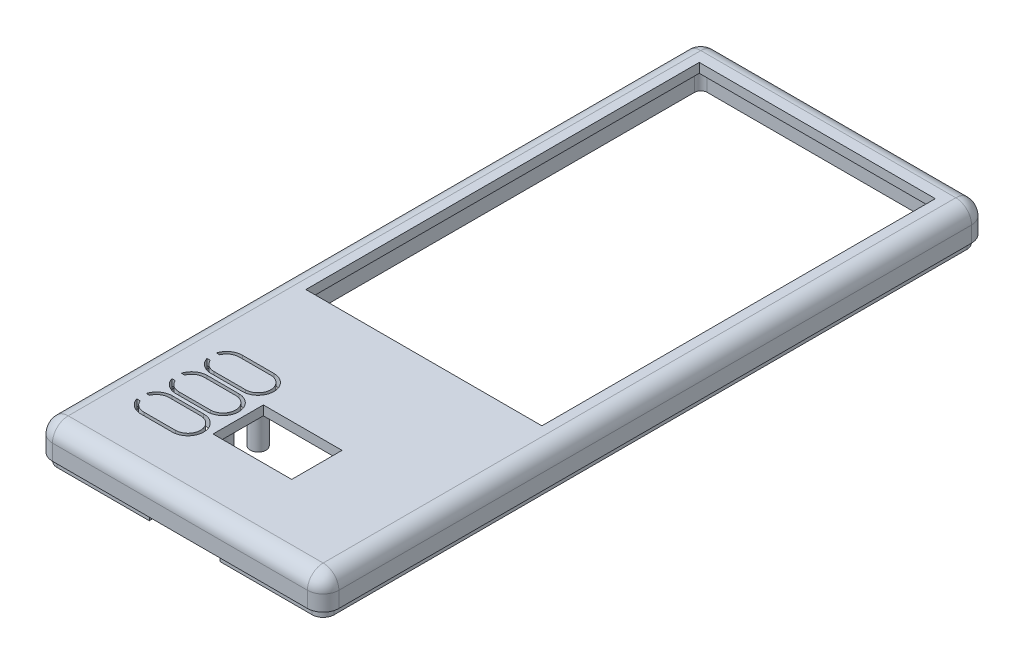
from build123d import *

# Parameters (mm, degrees)
SKETCH1_W           = 91
SKETCH1_H           = 211
BOSS_EXTRUDE1_DEPTH = 3
FILLET1_R           = 5
BOSS_EXTRUDE2_DEPTH = 7
CUT_EXTRUDE1_REACH  = 117.106
SKETCH3_W           = 25
SKETCH3_H           = 16
SKETCH4_R           = 2.499999999999999
BOSS_EXTRUDE3_DEPTH = 14.4
CUT_EXTRUDE4_REACH  = 117.792
SKETCH7_W           = 1.0616677240133683
SKETCH7_H           = 3.000000000000014
SKETCH7_W_2         = 1.0616677240133825
SKETCH7_W_3         = 1.0616677240133612
SKETCH7_H_2         = 3
CUT_EXTRUDE5_DEPTH  = 1
BOSS_EXTRUDE4_DEPTH = 2.5
FILLET2_R           = 5
CUT_EXTRUDE6_REACH  = 218.33


with BuildPart() as part:
    # Sketch1 → Boss-Extrude1 (new body)
    with BuildSketch(Plane(origin=(0, 0, 0), x_dir=(1, 0, 0), z_dir=(0, 1, 0))):
        Rectangle(SKETCH1_W, SKETCH1_H)
    extrude(amount=BOSS_EXTRUDE1_DEPTH)

    # Fillet1
    fillet1_edges = [part.edges().sort_by_distance(p)[0] for p in [
        (45.49999999999999, 1.5, -105.50000000000001),
        (-45.50000000000001, 1.5, -105.50000000000001),
        (-45.50000000000001, 1.5, 105.49999999999999),
        (45.49999999999999, 1.5, 105.49999999999999),
    ]]
    fillet(fillet1_edges, radius=FILLET1_R)

    # Sketch2 → Boss-Extrude2 (add)
    with BuildSketch(Plane.XZ):
        with BuildLine():
            Line((-40.499999999999964, -105.49999999999999), (40.49999999999995, -105.49999999999999))
            ThreePointArc((40.49999999999995, -105.49999999999999), (44.03553390593273, -104.03553390593272), (45.49999999999999, -100.49999999999996))
            Line((45.49999999999999, -100.49999999999996), (45.49999999999999, 100.49999999999996))
            ThreePointArc((45.49999999999999, 100.49999999999996), (44.03553390593273, 104.03553390593272), (40.49999999999995, 105.49999999999999))
            Line((40.49999999999995, 105.49999999999999), (-40.499999999999964, 105.49999999999999))
            ThreePointArc((-40.499999999999964, 105.49999999999999), (-44.03553390593273, 104.03553390593271), (-45.5, 100.49999999999996))
            Line((-45.5, 100.49999999999996), (-45.5, -100.49999999999996))
            ThreePointArc((-45.5, -100.49999999999996), (-44.03553390593274, -104.03553390593272), (-40.499999999999964, -105.49999999999999))
        make_face()
        with BuildLine():
            Line((-42.49999999999999, -100.49999999999996), (-42.49999999999999, 100.49999999999996))
            ThreePointArc((-42.49999999999999, 100.49999999999996), (-41.91421356237309, 101.91421356237306), (-40.499999999999986, 102.49999999999999))
            Line((-40.499999999999986, 102.49999999999999), (40.49999999999995, 102.49999999999999))
            ThreePointArc((40.49999999999995, 102.49999999999999), (41.914213562373085, 101.91421356237309), (42.49999999999999, 100.49999999999996))
            Line((42.49999999999999, 100.49999999999996), (42.499999999999986, -100.49999999999996))
            ThreePointArc((42.499999999999986, -100.49999999999996), (41.91421356237309, -101.91421356237308), (40.49999999999997, -102.49999999999999))
            Line((40.49999999999997, -102.49999999999999), (-40.499999999999964, -102.49999999999999))
            ThreePointArc((-40.499999999999964, -102.49999999999999), (-41.9142135623731, -101.91421356237308), (-42.49999999999999, -100.49999999999996))
        make_face(mode=Mode.SUBTRACT)
    extrude(amount=BOSS_EXTRUDE2_DEPTH)

    # Sketch3 → Cut-Extrude1 (cut, up to next)
    with BuildSketch(Plane.XZ, mode=Mode.PRIVATE) as cut_extrude1_sk1:
        Polygon((-37.50000000000003, 27.999999999999996), (37.49999999999997, 27.999999999999993), (37.499999999999986, -97), (-37.50000000000001, -97), align=None)
    cut_extrude1_tool1 = extrude(cut_extrude1_sk1.sketch, amount=-CUT_EXTRUDE1_REACH, mode=Mode.PRIVATE) & part.part
    # Sketch3 → Cut-Extrude1 (cut, up to next)
    with BuildSketch(Plane.XZ, mode=Mode.PRIVATE) as cut_extrude1_sk2:
        with Locations((-7.99e-15, 74.49999999999999)):
            Rectangle(SKETCH3_W, SKETCH3_H)
    cut_extrude1_tool2 = extrude(cut_extrude1_sk2.sketch, amount=-CUT_EXTRUDE1_REACH, mode=Mode.PRIVATE) & part.part
    add(cut_extrude1_tool1.solids().sort_by_distance((0, 0, -34.5))[0], mode=Mode.SUBTRACT)
    add(cut_extrude1_tool2.solids().sort_by_distance((0, 0, 74.5))[0], mode=Mode.SUBTRACT)

    # Sketch4 → Boss-Extrude3 (add)
    with BuildSketch(Plane.XZ):
        with Locations((-19.500000000000004, 83.44999999999997)):
            Circle(SKETCH4_R)
        with Locations((-19.499999999999996, 61.149999999999984)):
            Circle(SKETCH4_R)
        with Locations((-19.50000000000001, 72.29999999999997)):
            Circle(SKETCH4_R)
    extrude(amount=BOSS_EXTRUDE3_DEPTH)

    # Sketch5 → Cut-Extrude4 (cut, up to next)
    with BuildSketch(Plane.XZ, mode=Mode.PRIVATE) as cut_extrude4_sk1:
        with BuildLine():
            Line((-19.499999999999996, 87.44999999999997), (-29.5, 87.44999999999999))
            ThreePointArc((-29.5, 87.44999999999999), (-31.73609678257712, 86.76662660418015), (-33.2081687238052, 84.95))
            Line((-33.2081687238052, 84.95), (-34.26977162953215, 84.95))
            ThreePointArc((-34.26977162953215, 84.95), (-32.45807037601751, 87.48113127392654), (-29.500000000000007, 88.44999999999996))
            Line((-29.500000000000007, 88.44999999999996), (-19.499999999999993, 88.44999999999997))
            ThreePointArc((-19.499999999999993, 88.44999999999997), (-14.49999999999999, 83.44999999999997), (-19.499999999999996, 78.44999999999996))
            Line((-19.499999999999996, 78.44999999999996), (-29.545399744802786, 78.44999999999996))
            ThreePointArc((-29.545399744802786, 78.44999999999996), (-32.47642821141089, 79.43219789004968), (-34.269836447818555, 81.94999999999999))
            Line((-34.269836447818555, 81.94999999999999), (-33.20802976198858, 81.94999999999999))
            ThreePointArc((-33.20802976198858, 81.94999999999999), (-31.736039172051395, 80.13337702358305), (-29.500000000000007, 79.44999999999997))
            Line((-29.500000000000007, 79.44999999999997), (-19.499999999999996, 79.44999999999996))
            ThreePointArc((-19.499999999999996, 79.44999999999996), (-15.49999999999999, 83.44999999999997), (-19.499999999999996, 87.44999999999997))
        make_face()
    cut_extrude4_tool1 = extrude(cut_extrude4_sk1.sketch, amount=-CUT_EXTRUDE4_REACH, mode=Mode.PRIVATE) & part.part
    # Sketch5 → Cut-Extrude4 (cut, up to next)
    with BuildSketch(Plane.XZ, mode=Mode.PRIVATE) as cut_extrude4_sk2:
        with BuildLine():
            Line((-19.499999999999883, 76.29999999999998), (-29.499999999999883, 76.29999999999998))
            ThreePointArc((-29.499999999999883, 76.29999999999998), (-31.736096782576997, 75.61662660418014), (-33.20816872380508, 73.80000000000001))
            Line((-33.20816872380508, 73.80000000000001), (-34.26977162953204, 73.80000000000001))
            ThreePointArc((-34.26977162953204, 73.80000000000001), (-32.45807037601738, 76.33113127392653), (-29.49999999999989, 77.29999999999995))
            Line((-29.49999999999989, 77.29999999999995), (-19.49999999999988, 77.29999999999998))
            ThreePointArc((-19.49999999999988, 77.29999999999998), (-14.49999999999989, 72.29999999999997), (-19.499999999999883, 67.29999999999997))
            Line((-19.499999999999883, 67.29999999999997), (-29.545399744802673, 67.29999999999997))
            ThreePointArc((-29.545399744802673, 67.29999999999997), (-32.47642821141078, 68.28219789004969), (-34.26983644781844, 70.8))
            Line((-34.26983644781844, 70.8), (-33.208029761988456, 70.8))
            ThreePointArc((-33.208029761988456, 70.8), (-31.736039172051278, 68.98337702358307), (-29.49999999999989, 68.29999999999997))
            Line((-29.49999999999989, 68.29999999999997), (-19.499999999999883, 68.29999999999997))
            ThreePointArc((-19.499999999999883, 68.29999999999997), (-15.49999999999989, 72.29999999999997), (-19.499999999999883, 76.29999999999998))
        make_face()
    cut_extrude4_tool2 = extrude(cut_extrude4_sk2.sketch, amount=-CUT_EXTRUDE4_REACH, mode=Mode.PRIVATE) & part.part
    # Sketch5 → Cut-Extrude4 (cut, up to next)
    with BuildSketch(Plane.XZ, mode=Mode.PRIVATE) as cut_extrude4_sk3:
        with BuildLine():
            Line((-19.499999999999766, 65.14999999999998), (-29.499999999999766, 65.14999999999999))
            ThreePointArc((-29.499999999999766, 65.14999999999999), (-31.736096782576894, 64.46662660418015), (-33.208168723804974, 62.65))
            Line((-33.208168723804974, 62.65), (-34.269771629531924, 62.65))
            ThreePointArc((-34.269771629531924, 62.65), (-32.45807037601728, 65.18113127392654), (-29.499999999999773, 66.14999999999996))
            Line((-29.499999999999773, 66.14999999999996), (-19.499999999999762, 66.14999999999998))
            ThreePointArc((-19.499999999999762, 66.14999999999998), (-14.499999999999766, 61.14999999999997), (-19.499999999999766, 56.14999999999996))
            Line((-19.499999999999766, 56.14999999999996), (-29.545399744802552, 56.14999999999998))
            ThreePointArc((-29.545399744802552, 56.14999999999998), (-32.47642821141066, 57.13219789004967), (-34.26983644781833, 59.64999999999999))
            Line((-34.26983644781833, 59.64999999999999), (-33.20802976198835, 59.64999999999999))
            ThreePointArc((-33.20802976198835, 59.64999999999999), (-31.736039172051168, 57.83337702358305), (-29.499999999999773, 57.14999999999998))
            Line((-29.499999999999773, 57.14999999999998), (-19.499999999999766, 57.14999999999996))
            ThreePointArc((-19.499999999999766, 57.14999999999996), (-15.499999999999766, 61.14999999999997), (-19.499999999999766, 65.14999999999998))
        make_face()
    cut_extrude4_tool3 = extrude(cut_extrude4_sk3.sketch, amount=-CUT_EXTRUDE4_REACH, mode=Mode.PRIVATE) & part.part
    add(cut_extrude4_tool1.solids().sort_by_distance((-15.278449, 0, 83.45))[0], mode=Mode.SUBTRACT)
    add(cut_extrude4_tool2.solids().sort_by_distance((-24.5, 0, 76.521551))[0], mode=Mode.SUBTRACT)
    add(cut_extrude4_tool3.solids().sort_by_distance((-24.5, 0, 65.371551))[0], mode=Mode.SUBTRACT)

    # Sketch7 → Cut-Extrude5 (cut)
    with BuildSketch(Plane.XZ):
        with Locations((-33.73900258581189, 83.44999999999999)):
            Rectangle(SKETCH7_W, SKETCH7_H)
        with Locations((-33.73900258581176, 72.30000000000001)):
            Rectangle(SKETCH7_W_2, SKETCH7_H)
        with Locations((-33.739002585811654, 61.14999999999999)):
            Rectangle(SKETCH7_W_3, SKETCH7_H_2)
    extrude(amount=-CUT_EXTRUDE5_DEPTH, mode=Mode.SUBTRACT)

    # Sketch8 → Boss-Extrude4 (add)
    with BuildSketch(Plane.XZ.offset(7)):
        with BuildLine():
            Line((-44, 100.49999999999994), (-44, -100.49999999999996))
            ThreePointArc((-44, -100.49999999999996), (-42.9748737341529, -102.97487373415291), (-40.499999999999936, -103.99999999999999))
            Line((-40.499999999999936, -103.99999999999999), (40.49999999999999, -103.99999999999999))
            ThreePointArc((40.49999999999999, -103.99999999999999), (42.974873734152936, -102.97487373415288), (44, -100.49999999999993))
            Line((44, -100.49999999999993), (44, 100.49999999999996))
            ThreePointArc((44, 100.49999999999996), (42.974873734152894, 102.97487373415291), (40.49999999999992, 103.99999999999999))
            Line((40.49999999999992, 103.99999999999999), (-40.5, 103.99999999999999))
            ThreePointArc((-40.5, 103.99999999999999), (-42.974873734152936, 102.9748737341529), (-44, 100.49999999999994))
        make_face()
        with BuildLine():
            Line((40.49999999999995, 102.49999999999999), (-40.5, 102.49999999999999))
            ThreePointArc((-40.5, 102.49999999999999), (-41.91421356237311, 101.91421356237308), (-42.49999999999999, 100.49999999999996))
            Line((-42.49999999999999, 100.49999999999996), (-42.49999999999999, -100.49999999999996))
            ThreePointArc((-42.49999999999999, -100.49999999999996), (-41.914213562373085, -101.91421356237306), (-40.499999999999964, -102.49999999999999))
            Line((-40.499999999999964, -102.49999999999999), (40.49999999999999, -102.49999999999999))
            ThreePointArc((40.49999999999999, -102.49999999999999), (41.91421356237311, -101.91421356237308), (42.49999999999999, -100.49999999999996))
            Line((42.49999999999999, -100.49999999999996), (42.49999999999999, 100.49999999999996))
            ThreePointArc((42.49999999999999, 100.49999999999996), (41.91421356237308, 101.91421356237308), (40.49999999999995, 102.49999999999999))
        make_face(mode=Mode.SUBTRACT)
    extrude(amount=BOSS_EXTRUDE4_DEPTH)

    # Fillet2
    fillet2_edges = [part.edges().sort_by_distance(p)[0] for p in [
        (44.03553390593273, 3, 104.03553390593272),
        (-7.11e-15, 3, 105.49999999999999),
        (-44.035533905932745, 3, 104.03553390593272),
        (-45.50000000000001, 3, -1.421e-14),
        (-44.035533905932745, 3, -104.03553390593275),
        (-7.11e-15, 3, -105.50000000000001),
        (44.03553390593273, 3, -104.03553390593275),
        (45.49999999999999, 3, -1.421e-14),
    ]]
    fillet(fillet2_edges, radius=FILLET2_R)

    # Sketch9 → Cut-Extrude6 (cut, up to next)
    with BuildSketch(Plane.XY.offset(105.49999999999999), mode=Mode.PRIVATE) as cut_extrude6_sk1:
        Polygon((-11.249999999999996, -7.000000000000001), (11.250000000000004, -7.000000000000001), (11.250000000000002, -9.5), (-11.249999999999995, -9.5), align=None)
    cut_extrude6_tool1 = extrude(cut_extrude6_sk1.sketch, amount=-CUT_EXTRUDE6_REACH, mode=Mode.PRIVATE) & part.part
    add(cut_extrude6_tool1.solids().sort_by_distance((0, -8.25, 105.5))[0], mode=Mode.SUBTRACT)


solid = part.part
